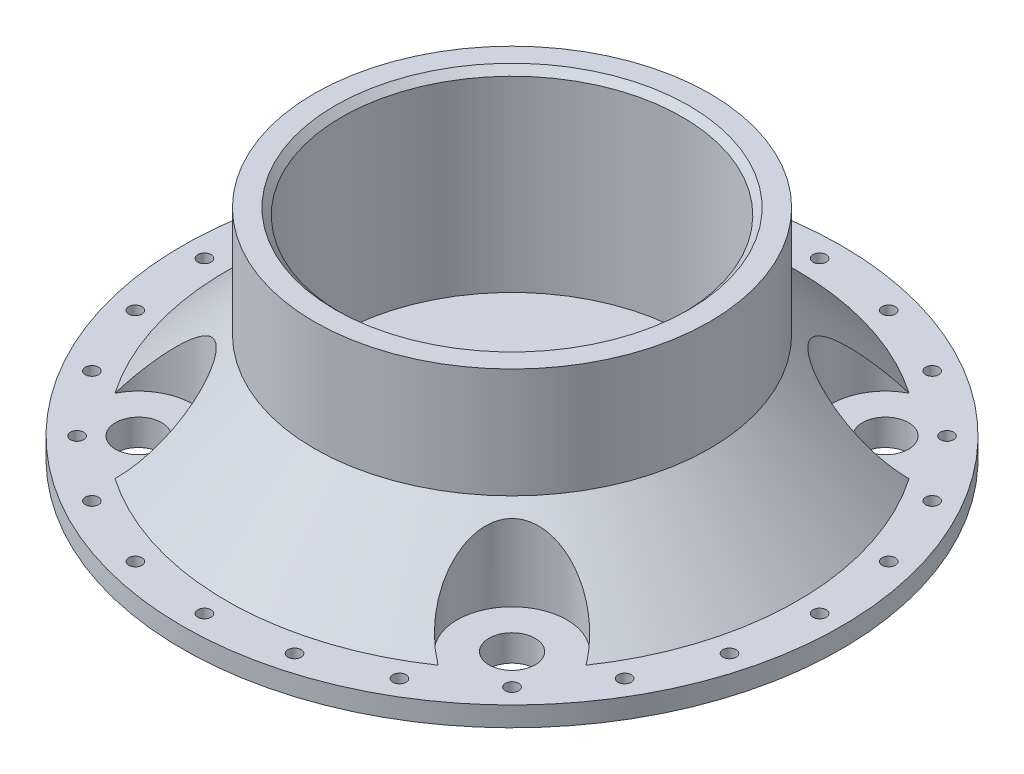
from build123d import *

# Parameters (mm, degrees)
SKETCH2_R                                  = 75
BOSS_EXTRUDE1_DEPTH                        = 6
SKETCH3_R                                  = 45
BOSS_EXTRUDE2_DEPTH                        = 45
SKETCH4_R                                  = 40
CUT_EXTRUDE1_DEPTH                         = 45
SKETCH7_R                                  = 1.5
CUT_EXTRUDE4_DEPTH                         = 116.217186218
CIRPATTERN2_COUNT                          = 24
SKETCH8_R                                  = 5.25
CUT_EXTRUDE5_DEPTH                         = 116.217186218
LPATTERN2_COUNT                            = 2
LPATTERN2_PITCH                            = 85
LPATTERN2_COUNT_DIR2                       = 2
LPATTERN2_PITCH_DIR2                       = 85
SKETCH9_R                                  = 12.5
CUT_EXTRUDE6_DEPTH                         = 116.217186218
MIRROR1_AT_THE_SECOND_PLANE_COPY_1_SKETC_R = 12.5
MIRROR1_AT_THE_SECOND_PLANE_COPY_1_DEPTH   = 116.217186218
SKETCH14_R                                 = 75
SKETCH14_R_2                               = 68.5
CUT_EXTRUDE8_DEPTH                         = 1.5
SKETCH15_R                                 = 40
SKETCH15_R_2                               = 38.75
BOSS_EXTRUDE4_DEPTH                        = 1.5
CHAMFER3_SIZE                              = 1.5


# Some blends are built 0.0001 mm under size
with BuildPart() as part:
    # Sketch2 → Boss-Extrude1 (new body)
    with BuildSketch(Plane(origin=(0, 0, 0), x_dir=(1, 0, 0), z_dir=(0, 1, 0))):
        with Locations(Location((0, 0, 0), (0, 0, 270))):
            Circle(SKETCH2_R)
    extrude(amount=BOSS_EXTRUDE1_DEPTH)

    # Sketch3 → Boss-Extrude2 (add)
    with BuildSketch(Plane(origin=(0, 6, 0), x_dir=(1, 0, 0), z_dir=(0, 1, 0))):
        with Locations(Location((0, 0, 0), (0, 0, 90))):
            Circle(SKETCH3_R)
    extrude(amount=BOSS_EXTRUDE2_DEPTH)

    # Sketch4 → Cut-Extrude1 (cut)
    with BuildSketch(Plane(origin=(0, 51, 0), x_dir=(1, 0, 0), z_dir=(0, 1, 0))):
        with Locations(Location((0, 0, 0), (0, 0, 270))):
            Circle(SKETCH4_R)
    extrude(amount=-CUT_EXTRUDE1_DEPTH, mode=Mode.SUBTRACT)

    # Sketch7 → Cut-Extrude4 (cut, through all)
    with BuildSketch(Plane(origin=(0, 6, 0), x_dir=(1, 0, 0), z_dir=(0, 1, 0))):
        with Locations(Location((0, -70, 0), (0, 0, 270))):
            Circle(SKETCH7_R)
    cut_extrude4 = extrude(amount=-CUT_EXTRUDE4_DEPTH, mode=Mode.SUBTRACT)

    # CirPattern2: Cut-Extrude4 ×24 about axis
    cirpattern2_axis = Axis((0, 0, 0), (0, 1, 0))
    for i in range(1, CIRPATTERN2_COUNT):
        add(cut_extrude4.rotate(cirpattern2_axis, i * 360 / CIRPATTERN2_COUNT), mode=Mode.SUBTRACT)

    # Sketch8 → Cut-Extrude5 (cut, through all)
    with BuildSketch(Plane(origin=(0, 6, 0), x_dir=(1, 0, 0), z_dir=(0, 1, 0))):
        with Locations(Location((-42.5, 42.5, 0), (0, 0, 270))):
            Circle(SKETCH8_R)
    cut_extrude5 = extrude(amount=-CUT_EXTRUDE5_DEPTH, mode=Mode.SUBTRACT)

    # LPattern2: Cut-Extrude5 2 × 2
    with Locations(*[(i * LPATTERN2_PITCH, 0, j * LPATTERN2_PITCH_DIR2) for i in range(LPATTERN2_COUNT) for j in range(LPATTERN2_COUNT_DIR2) if (i, j) != (0, 0)]):
        add(cut_extrude5, mode=Mode.SUBTRACT)

    # Chamfer2
    # the kernel refuses this chamfer: 20 mm, written as the material it adds along each edge
    with BuildSketch(Plane(origin=(0, 6, 0), x_dir=(0, 0, -1), z_dir=(1, 0, 0))) as chamfer2_piece_1_section:
        with BuildLine():
            Line((65.565685425, -0.565685425), (44.434314575, 20.565685425))
            Line((44.434314575, 20.565685425), (44.034314575, 20.565685425))
            ThreePointArc((44.034314575, 20.565685425), (44.6, 10.282842712), (44.6, 0))
            Line((44.6, 0), (45, -0.4))
            ThreePointArc((45, -0.4), (55.282842712, -0.4), (65.565685425, -0.965685425))
            Line((65.565685425, -0.965685425), (65.565685425, -0.565685425))
        make_face()
    chamfer2_piece_1 = revolve(axis=Axis((0, 6, 0), (0, 1, 0)), mode=Mode.PRIVATE)
    chamfer2_piece_1 = chamfer2_piece_1 - Plane(origin=(-42.5, 15.709329552, 42.5), x_dir=(0, 0, 1), z_dir=(0, 1, 0)) * Cylinder(5.25, 263, mode=Mode.PRIVATE)
    chamfer2_piece_1 = chamfer2_piece_1 - Plane(origin=(42.5, 15.709329552, 42.5), x_dir=(0, 0, 1), z_dir=(0, 1, 0)) * Cylinder(5.25, 263, mode=Mode.PRIVATE)
    chamfer2_piece_1 = chamfer2_piece_1 - Plane(origin=(-42.5, 15.709329552, -42.5), x_dir=(0, 0, 1), z_dir=(0, 1, 0)) * Cylinder(5.25, 263, mode=Mode.PRIVATE)
    chamfer2_piece_1 = chamfer2_piece_1 - Plane(origin=(42.5, 15.709329552, -42.5), x_dir=(0, 0, 1), z_dir=(0, 1, 0)) * Cylinder(5.25, 263, mode=Mode.PRIVATE)
    add(chamfer2_piece_1)

    # Sketch9 → Cut-Extrude6 (cut, through all)
    with BuildSketch(Plane(origin=(0, 6, 0), x_dir=(1, 0, 0), z_dir=(0, 1, 0))):
        with Locations((-42.5, -42.5)):
            Circle(SKETCH9_R)
    cut_extrude6 = extrude(amount=CUT_EXTRUDE6_DEPTH, mode=Mode.SUBTRACT)

    # Mirror1: Cut-Extrude6 across plane
    add(cut_extrude6.mirror(Plane(origin=(0, 0, 0), x_dir=(0, 0, 1), z_dir=(1, 0, 0))), mode=Mode.SUBTRACT)

    # Mirror1 at the second plane: Cut-Extrude6 across plane
    add(cut_extrude6.mirror(Plane.XY), mode=Mode.SUBTRACT)

    # Mirror1 at the second plane copy 1 sketc → Mirror1 at the second plane copy 1 (cut, through all)
    with BuildSketch(Plane(origin=(0, 6, 0), x_dir=(-1, 0, 0), z_dir=(0, 1, 0))):
        with Locations((-42.5, -42.5)):
            Circle(MIRROR1_AT_THE_SECOND_PLANE_COPY_1_SKETC_R)
    extrude(amount=MIRROR1_AT_THE_SECOND_PLANE_COPY_1_DEPTH, mode=Mode.SUBTRACT)

    # Sketch14 → Cut-Extrude8 (cut)
    with BuildSketch(Plane(origin=(0, 0, 0), x_dir=(-1, 0, 0), z_dir=(0, -1, 0))):
        with Locations(Location((0, 0, 0), (0, 0, 90))):
            Circle(SKETCH14_R)
        with Locations(Location((0, 0, 0), (0, 0, 90))):
            Circle(SKETCH14_R_2, mode=Mode.SUBTRACT)
    extrude(amount=-CUT_EXTRUDE8_DEPTH, mode=Mode.SUBTRACT)

    # Sketch15 → Boss-Extrude4 (add)
    with BuildSketch(Plane(origin=(0, 51, 0), x_dir=(1, 0, 0), z_dir=(0, 1, 0))):
        with Locations(Location((0, 0, 0), (0, 0, 270))):
            Circle(SKETCH15_R)
        with Locations(Location((0, 0, 0), (0, 0, 270))):
            Circle(SKETCH15_R_2, mode=Mode.SUBTRACT)
    extrude(amount=-BOSS_EXTRUDE4_DEPTH)

    # Chamfer3
    chamfer3_edges = [part.edges().sort_by_distance(p)[0] for p in [
        (0, 51, -38.75),
    ]]
    chamfer(chamfer3_edges, length=CHAMFER3_SIZE - 0.0001)  # a hair under: the kernel refuses the full size


solid = part.part
